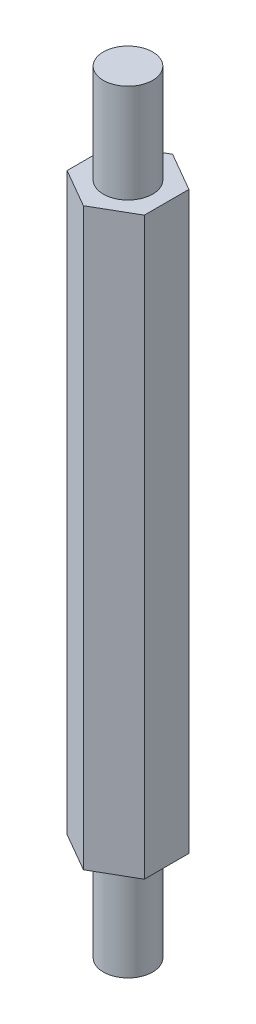
from build123d import *

# Parameters (mm, degrees)
BOSS_EXTRUDE1_DEPTH = 35
SKETCH2_R           = 1.5
BOSS_EXTRUDE2_DEPTH = 6
BOSS_EXTRUDE3_START = 6
SKETCH5_R           = 1.5
BOSS_EXTRUDE3_DEPTH = 6


with BuildPart() as part:
    # Sketch1 → Boss-Extrude1 (new body)
    with BuildSketch(Plane(origin=(0, 0, 0), x_dir=(1, 0, 0), z_dir=(0, 1, 0))):
        Polygon((0, 2.713546265), (-2.35, 1.356773133), (-2.35, -1.356773133), (0, -2.713546265), (2.35, -1.356773133), (2.35, 1.356773133), align=None)
    extrude(amount=BOSS_EXTRUDE1_DEPTH)

    # Sketch2 → Boss-Extrude2 (add)
    with BuildSketch(Plane(origin=(0, 35, 0), x_dir=(1, 0, 0), z_dir=(0, 1, 0))):
        Circle(SKETCH2_R)
    extrude(amount=BOSS_EXTRUDE2_DEPTH)

    # Sketch5 → Boss-Extrude3 (add)
    with BuildSketch(Plane.XZ.offset(BOSS_EXTRUDE3_START)):
        Circle(SKETCH5_R)
    extrude(amount=-BOSS_EXTRUDE3_DEPTH)


solid = part.part
